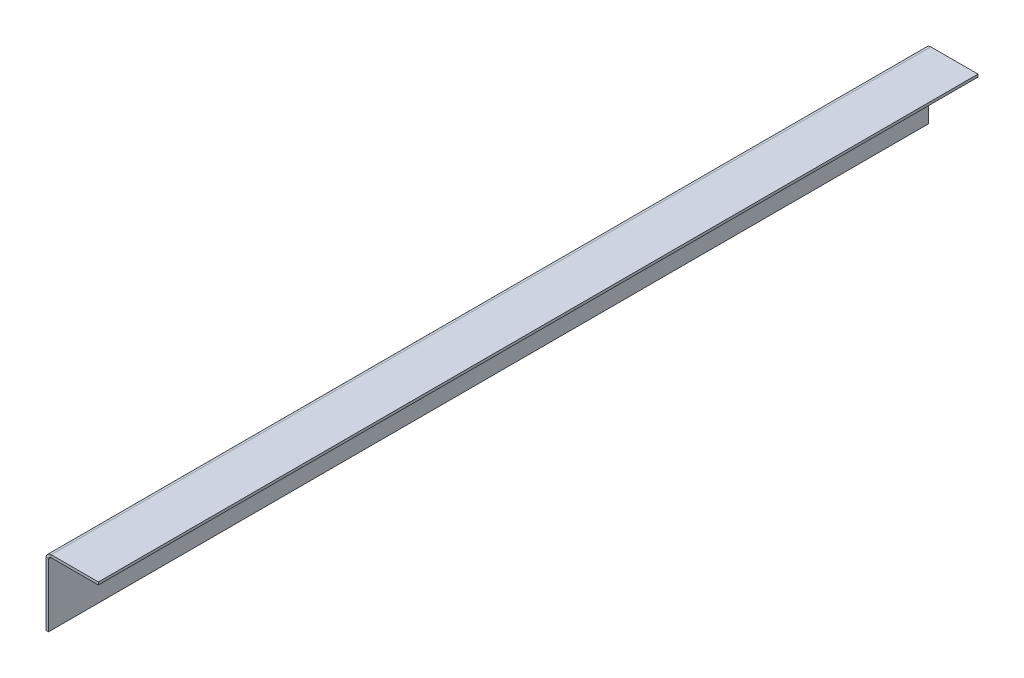
from build123d import *

# Parameters (mm, degrees)
SKETCH1_W                    = 1066.8
SKETCH1_H                    = 82.55
BASE_FLANGE1_DEPTH           = 3.175
EDGE_FLANGE1_STRIP_W         = 19.05
EDGE_FLANGE1_STRIP_H         = 3.175
EDGE_FLANGE1_STRIP_CUT_DEPTH = 1066.8
EDGE_FLANGE1_DEPTH           = 1066.8


# Sheet-metal steps are written as plain solids
with BuildPart() as part:
    # Sketch1 → Base-Flange1 (new body)
    with BuildSketch(Plane(origin=(0, 0, 0), x_dir=(0, 0, -1), z_dir=(1, 0, 0))):
        with Locations((533.4, 41.275)):
            Rectangle(SKETCH1_W, SKETCH1_H)
    extrude(amount=-BASE_FLANGE1_DEPTH)

    # Edge-Flange1 strip (across the edge) → Edge-Flange1 strip cut (cut)
    with BuildSketch(Plane(origin=(0, 82.55, -1066.8), x_dir=(0, -1, 0), z_dir=(0, 0, 1))):
        with Locations((-3.175, -1.5875)):
            Rectangle(EDGE_FLANGE1_STRIP_W, EDGE_FLANGE1_STRIP_H)
    extrude(amount=EDGE_FLANGE1_STRIP_CUT_DEPTH, mode=Mode.SUBTRACT)

    # Edge-Flange1 section (across the edge) → Edge-Flange1 (add)
    with BuildSketch(Plane(origin=(0, 82.55, -1066.8), x_dir=(0, -1, 0), z_dir=(0, 0, 1))):
        with BuildLine():
            Line((0, 3.175), (0, 60.325))
            Line((0, 60.325), (3.175, 60.325))
            Line((3.175, 60.325), (3.175, 3.175))
            ThreePointArc((3.175, 3.175), (4.10493597, 0.92993597), (6.35, 0))
            Line((6.35, 0), (6.35, -3.175))
            ThreePointArc((6.35, -3.175), (1.859871939, -1.315128061), (0, 3.175))
        make_face()
    extrude(amount=EDGE_FLANGE1_DEPTH)


solid = part.part
